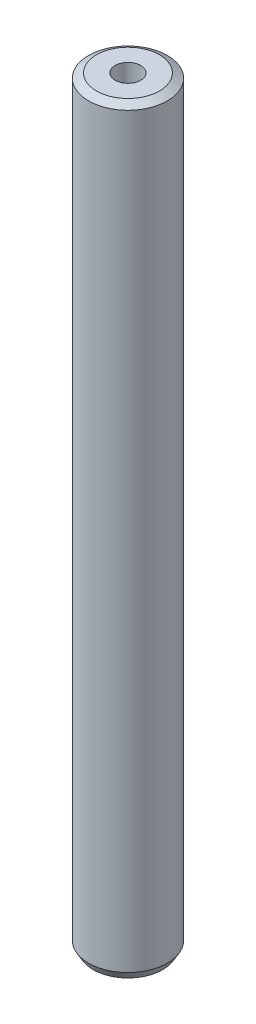
from build123d import *
from OCP.BRepFilletAPI import BRepFilletAPI_MakeChamfer

# Parameters (mm, degrees)
SKETCH1_R           = 10
BOSS_EXTRUDE1_DEPTH = 192.751851065
SKETCH2_R           = 3.249975369
CUT_EXTRUDE1_DEPTH  = 194.269956509
CHAMFER1_SIZE       = 1.166427446
CHAMFER1_SIZE2      = 2.0203116


with BuildPart() as part:
    # Sketch1 → Boss-Extrude1 (new body)
    with BuildSketch(Plane(origin=(0, 0, 0), x_dir=(1, 0, 0), z_dir=(0, 1, 0))):
        Circle(SKETCH1_R)
    extrude(amount=BOSS_EXTRUDE1_DEPTH)

    # Sketch2 → Cut-Extrude1 (cut, through all)
    with BuildSketch(Plane(origin=(0, 0, 0), x_dir=(1, 0, 0), z_dir=(0, 1, 0))):
        Circle(SKETCH2_R)
    extrude(amount=CUT_EXTRUDE1_DEPTH, mode=Mode.SUBTRACT)

    # Chamfer1: one chamfer whose edges measure the first distance from different faces: ONE call of the kernel's chamfer builder (chamfer() names one face for all edges)
    chamfer1_edges_1 = [part.edges().sort_by_distance(p)[0] for p in [
        (-10, 192.751851065, 0),
    ]]
    chamfer1_side_1 = [part.faces().sort_by_distance(p)[0] for p in [
        (-10, 96.375925532, 0),
    ]]
    chamfer1_edges_2 = [part.edges().sort_by_distance(p)[0] for p in [
        (-10, 0, 0),
    ]]
    chamfer1_side_2 = [part.faces().sort_by_distance(p)[0] for p in [
        (-9.717157288, 0, 0),
    ]]
    chamfer1 = BRepFilletAPI_MakeChamfer(part.part.solid().wrapped)
    for e in chamfer1_edges_1:
        chamfer1.Add(CHAMFER1_SIZE, CHAMFER1_SIZE2, e.wrapped, chamfer1_side_1[0].wrapped)  # the first distance lies on this face
    for e in chamfer1_edges_2:
        chamfer1.Add(CHAMFER1_SIZE, CHAMFER1_SIZE2, e.wrapped, chamfer1_side_2[0].wrapped)  # the first distance lies on this face
    add(Compound.cast(chamfer1.Shape()), mode=Mode.REPLACE)


solid = part.part
